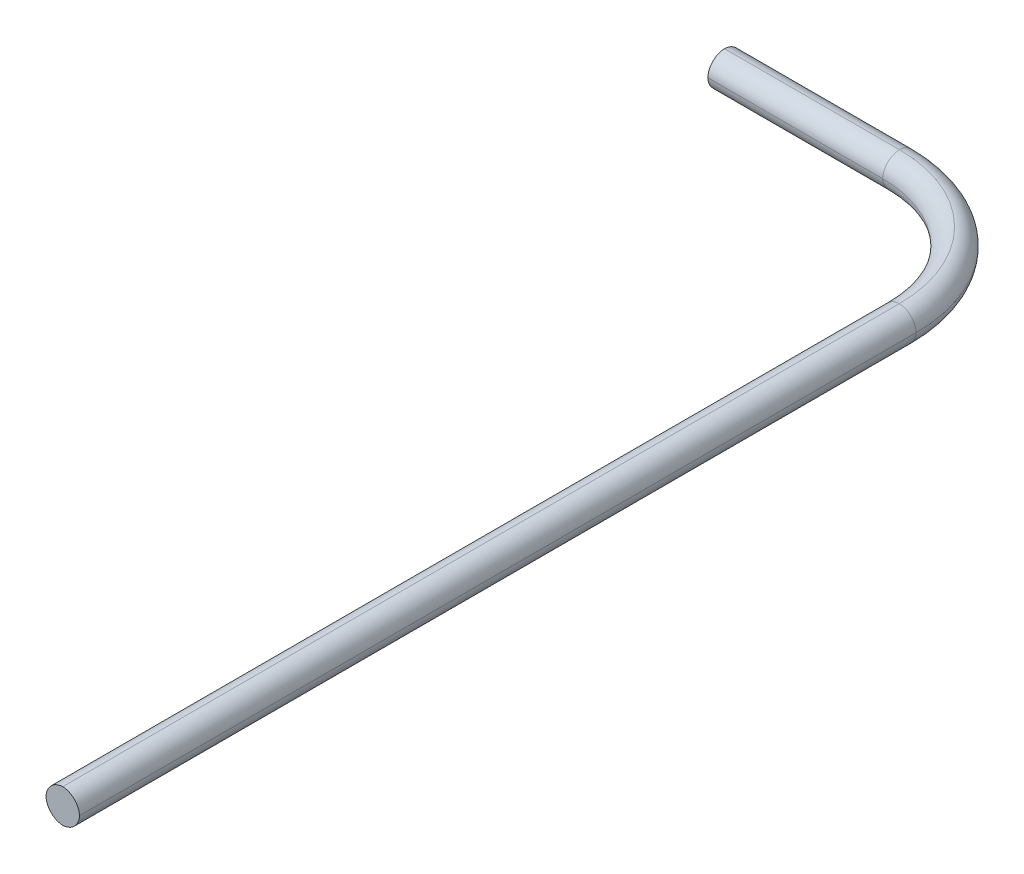
from build123d import *

# Parameters (mm, degrees)
SKETCH1_W           = 11.5
SKETCH1_H           = 11.5
BOSS_EXTRUDE1_DEPTH = 338.5
SKETCH2_W           = 11.5
SKETCH2_H           = 11.5
BOSS_EXTRUDE2_DEPTH = 100
FILLET1_R           = 40
FILLET2_R           = 51.5
FILLET3_R           = 6


with BuildPart() as part:
    # Sketch1 → Boss-Extrude1 (new body)
    with BuildSketch(Plane.XY):
        Rectangle(SKETCH1_W, SKETCH1_H)
    extrude(amount=BOSS_EXTRUDE1_DEPTH)

    # Sketch2 → Boss-Extrude2 (add)
    with BuildSketch(Plane.ZY.offset(5.75)):
        with Locations((5.75, 0)):
            Rectangle(SKETCH2_W, SKETCH2_H)
    extrude(amount=BOSS_EXTRUDE2_DEPTH)

    # Fillet1
    fillet1_edges = [part.edges().sort_by_distance(p)[0] for p in [
        (-5.75, 0, 11.5),
    ]]
    fillet(fillet1_edges, radius=FILLET1_R)

    # Fillet2
    fillet2_edges = [part.edges().sort_by_distance(p)[0] for p in [
        (5.75, 0, 0),
    ]]
    fillet(fillet2_edges, radius=FILLET2_R)

    # Fillet3
    # the kernel refuses this fillet: 6 mm, written as the material it takes off along each edge
    with BuildSketch(Plane(origin=(-5.75, -5.75, 51.5), x_dir=(0, 1, 0), z_dir=(0, 0, 1)), Plane(origin=(-5.75, 5.75, 51.5), x_dir=(1, 0, 0), z_dir=(0, 0, 1))) as fillet3_piece_1:
        with BuildLine():
            CenterArc((FILLET3_R, -FILLET3_R), FILLET3_R, 90, 90)
            Line((0, -FILLET3_R), (0, 0))
            Line((0, 0), (FILLET3_R, 0))
        make_face()
    extrude(amount=302, mode=Mode.SUBTRACT)
    with BuildSketch(Plane(origin=(-45.75, -5.75, 51.5), x_dir=(0, 0, -1), z_dir=(-1, 0, 0))) as fillet3_piece_2:
        with BuildLine():
            CenterArc((40 + FILLET3_R, -FILLET3_R), FILLET3_R, 90, 90)
            Line((40 + FILLET3_R, 0), (40, 0))
            Line((40, 0), (40, -FILLET3_R))
        make_face()
    revolve(axis=Axis((-45.75, -5.75, 51.5), (0, -1, 0)), revolution_arc=90, mode=Mode.SUBTRACT)
    with BuildSketch(Plane(origin=(-45.75, 5.75, 51.5), x_dir=(0, 0, -1), z_dir=(-1, 0, 0))) as fillet3_piece_3:
        with BuildLine():
            CenterArc((40 + FILLET3_R, FILLET3_R), FILLET3_R, 180, 90)
            Line((40, FILLET3_R), (40, 0))
            Line((40, 0), (40 + FILLET3_R, 0))
        make_face()
    revolve(axis=Axis((-45.75, 5.75, 51.5), (0, -1, 0)), revolution_arc=90, mode=Mode.SUBTRACT)
    with BuildSketch(Plane(origin=(5.75, -5.75, 51.5), x_dir=(0, 1, 0), z_dir=(0, 0, 1)), Plane(origin=(5.75, 5.75, 51.5), x_dir=(-1, 0, 0), z_dir=(0, 0, 1))) as fillet3_piece_4:
        with BuildLine():
            CenterArc((FILLET3_R, FILLET3_R), FILLET3_R, 180, 90)
            Line((0, FILLET3_R), (0, 0))
            Line((0, 0), (FILLET3_R, 0))
        make_face()
    extrude(amount=302, mode=Mode.SUBTRACT)
    with BuildSketch(Plane(origin=(-45.75, -5.75, 51.5), x_dir=(1, 0, 0), z_dir=(0, 0, 1))) as fillet3_piece_5:
        with BuildLine():
            CenterArc((51.5 - FILLET3_R, FILLET3_R), FILLET3_R, 270, 90)
            Line((51.5 - FILLET3_R, 0), (51.5, 0))
            Line((51.5, 0), (51.5, FILLET3_R))
        make_face()
    revolve(axis=Axis((-45.75, -5.75, 51.5), (0, 1, 0)), revolution_arc=90, mode=Mode.SUBTRACT)
    with BuildSketch(Plane(origin=(-45.75, 5.75, 51.5), x_dir=(1, 0, 0), z_dir=(0, 0, 1))) as fillet3_piece_6:
        with BuildLine():
            CenterArc((51.5 - FILLET3_R, -FILLET3_R), FILLET3_R, 0, 90)
            Line((51.5, -FILLET3_R), (51.5, 0))
            Line((51.5, 0), (51.5 - FILLET3_R, 0))
        make_face()
    revolve(axis=Axis((-45.75, 5.75, 51.5), (0, 1, 0)), revolution_arc=90, mode=Mode.SUBTRACT)
    with BuildSketch(Plane(origin=(-45.75, -5.75, 11.5), x_dir=(0, 1, 0), z_dir=(-1, 0, 0)), Plane(origin=(-45.75, 5.75, 11.5), x_dir=(0, 0, -1), z_dir=(-1, 0, 0))) as fillet3_piece_7:
        with BuildLine():
            CenterArc((FILLET3_R, FILLET3_R), FILLET3_R, 180, 90)
            Line((0, FILLET3_R), (0, 0))
            Line((0, 0), (FILLET3_R, 0))
        make_face()
    extrude(amount=75, mode=Mode.SUBTRACT)
    with BuildSketch(Plane(origin=(-45.75, -5.75, 0), x_dir=(0, 1, 0), z_dir=(-1, 0, 0)), Plane(origin=(-45.75, 5.75, 0), x_dir=(0, 0, 1), z_dir=(-1, 0, 0))) as fillet3_piece_8:
        with BuildLine():
            CenterArc((FILLET3_R, -FILLET3_R), FILLET3_R, 90, 90)
            Line((0, -FILLET3_R), (0, 0))
            Line((0, 0), (FILLET3_R, 0))
        make_face()
    extrude(amount=75, mode=Mode.SUBTRACT)


solid = part.part
